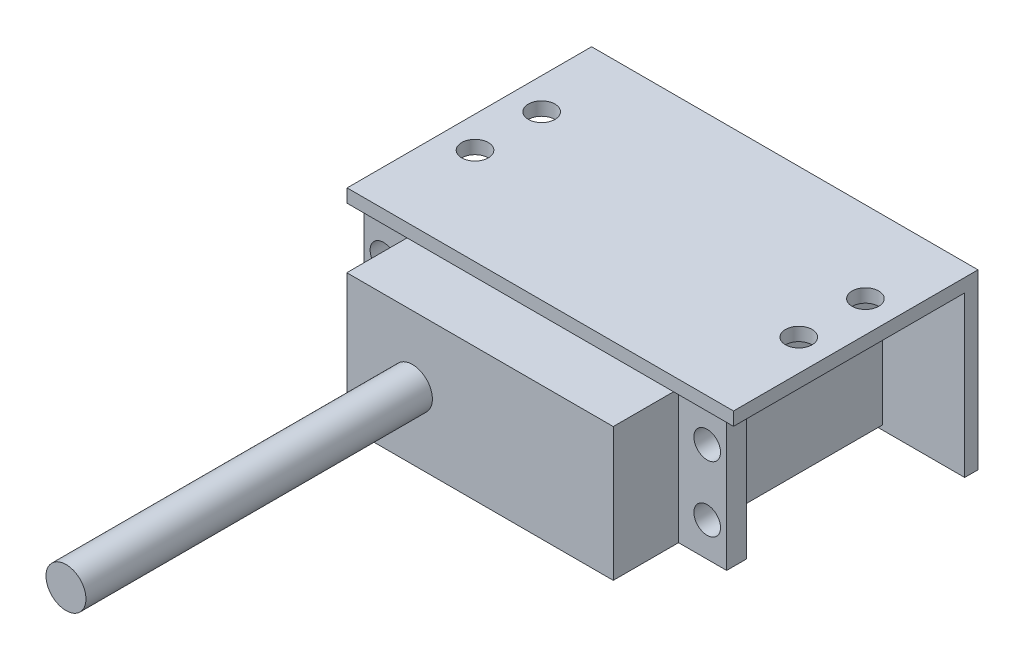
from build123d import *

# Parameters (mm, degrees)
SKETCH2_W           = 40
SKETCH2_H           = 20
BOSS_EXTRUDE1_DEPTH = 40.45
BOSS_EXTRUDE2_START = -12.8
SKETCH2_3_W         = 7.22
SKETCH2_3_H         = 20
SKETCH2_3_R         = 2
BOSS_EXTRUDE2_DEPTH = 3
SKETCH2_4_R         = 3
BOSS_EXTRUDE3_DEPTH = 52
SKETCH3_W           = 58
SKETCH3_H           = 36.7
SKETCH3_R           = 2
BOSS_EXTRUDE4_DEPTH = 2
SKETCH4_W           = 58
SKETCH4_H           = 2
BOSS_EXTRUDE5_DEPTH = 24


with BuildPart() as part:
    # Sketch2 → Boss-Extrude1 (new body)
    with BuildSketch(Plane.XY):
        Rectangle(SKETCH2_W, SKETCH2_H)
    extrude(amount=-BOSS_EXTRUDE1_DEPTH)

    # Sketch2<3> → Boss-Extrude2 (add)
    # profile 1 of 2: a face of its own
    with BuildSketch(Plane.XY.offset(BOSS_EXTRUDE2_START)):
        with Locations((-23.61, 0)):
            Rectangle(SKETCH2_3_W, SKETCH2_3_H)
        with Locations((-24.3, -4.9)):
            Circle(SKETCH2_3_R, mode=Mode.SUBTRACT)
        with Locations((-24.3, 4.9)):
            Circle(SKETCH2_3_R, mode=Mode.SUBTRACT)
    # profile 2 of 2: a face of its own
    with BuildSketch(Plane.XY.offset(BOSS_EXTRUDE2_START)):
        with Locations((23.61, 0)):
            Rectangle(SKETCH2_3_W, SKETCH2_3_H)
        with Locations((24.3, -4.9)):
            Circle(SKETCH2_3_R, mode=Mode.SUBTRACT)
        with Locations((24.3, 4.9)):
            Circle(SKETCH2_3_R, mode=Mode.SUBTRACT)
    extrude(amount=BOSS_EXTRUDE2_DEPTH)

    # Sketch2<4> → Boss-Extrude3 (add)
    with BuildSketch(Plane.XY):
        with Locations((-10.15, 0)):
            Circle(SKETCH2_4_R)
    extrude(amount=BOSS_EXTRUDE3_DEPTH)

    # Sketch3 → Boss-Extrude4 (add)
    with BuildSketch(Plane(origin=(0, 10, 0), x_dir=(1, 0, 0), z_dir=(0, 1, 0))):
        with Locations((0, 27.4)):
            Rectangle(SKETCH3_W, SKETCH3_H)
        with Locations((-24.3, 33.55)):
            Circle(SKETCH3_R, mode=Mode.SUBTRACT)
        with Locations((-24.3, 23.55)):
            Circle(SKETCH3_R, mode=Mode.SUBTRACT)
        with Locations((24.3, 33.55)):
            Circle(SKETCH3_R, mode=Mode.SUBTRACT)
        with Locations((24.3, 23.55)):
            Circle(SKETCH3_R, mode=Mode.SUBTRACT)
    extrude(amount=BOSS_EXTRUDE4_DEPTH)

    # Sketch4 → Boss-Extrude5 (add)
    with BuildSketch(Plane.XZ.offset(-10)):
        with Locations((0, -44.75)):
            Rectangle(SKETCH4_W, SKETCH4_H)
    extrude(amount=BOSS_EXTRUDE5_DEPTH)


solid = part.part
